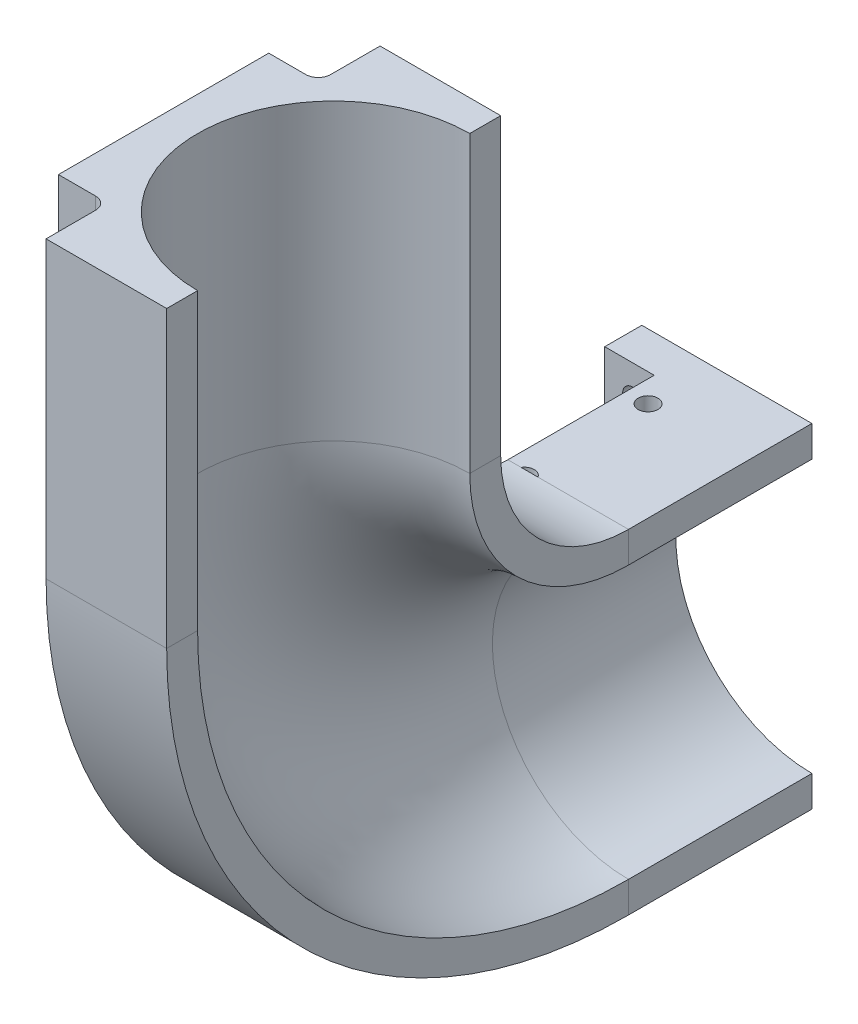
from build123d import *

# Parameters (mm, degrees)
EXTRUDE_1_DEPTH     = 6
SKETCH_4_R          = 1.6
CUT_EXTRUDE_1_DEPTH = 123.810830164
SKETCH_5_R          = 1.6
CUT_EXTRUDE_2_DEPTH = 20


with BuildPart() as part:
    # 草图1 → 凸台-拉伸1 (new body)
    with BuildSketch(Plane.XY):
        with BuildLine():
            Line((0, 0), (27.5, 0))
            Line((27.5, 0), (27.5, -5))
            ThreePointArc((27.5, -5), (5.5, -27), (27.5, -49))
            Line((27.5, -49), (27.5, -54))
            Line((27.5, -54), (0, -54))
            Line((0, -54), (0, 0))
        make_face()
    extrude(amount=EXTRUDE_1_DEPTH)

    # 扫描1: sweep along a path in 草图3
    with BuildLine(Plane(origin=(27.5, 0, 0), x_dir=(0, 0, -1), z_dir=(1, 0, 0))) as sweep_1_path:
        Line((-6, -27), (-29.66, -27))
        ThreePointArc((-29.66, -27), (-63.360709191, -13.040709191), (-77.32, 20.66))
        Line((-77.32, 20.66), (-77.32, 68.26))
    # 草图2 → 扫描1 (sweep)
    with BuildSketch(Plane.XY.offset(6)):
        with BuildLine():
            Line((8, 0), (8, -8))
            ThreePointArc((8, -8), (7.414213562, -9.414213562), (6, -10))
            Line((6, -10), (0, -10))
            Line((0, -10), (0, -44))
            Line((0, -44), (6, -44))
            ThreePointArc((6, -44), (7.414213562, -44.585786438), (8, -46))
            Line((8, -46), (8, -54))
            Line((8, -54), (27.5, -54))
            Line((27.5, -54), (27.5, -49))
            ThreePointArc((27.5, -49), (5.5, -27), (27.5, -5))
            Line((27.5, -5), (27.5, 0))
            Line((27.5, 0), (8, 0))
        make_face()
    sweep(path=sweep_1_path.line)

    # 草图4 → 切除-拉伸1 (cut, through all)
    with BuildSketch(Plane.XY.offset(6)):
        with Locations((4.5, -5)):
            Circle(SKETCH_4_R)
    cut_extrude_1 = extrude(amount=-CUT_EXTRUDE_1_DEPTH, mode=Mode.SUBTRACT)

    # 镜向1: 切除-拉伸1 across plane
    add(cut_extrude_1.mirror(Plane.ZX.offset(-27)), mode=Mode.SUBTRACT)

    # 草图5 → 切除-拉伸2 (cut)
    with BuildSketch(Plane(origin=(0, 0, 0), x_dir=(1, 0, 0), z_dir=(0, 1, 0))):
        with Locations((11.5, -10.5)):
            Circle(SKETCH_5_R)
        with Locations((11.5, -30.5)):
            Circle(SKETCH_5_R)
    extrude(amount=-CUT_EXTRUDE_2_DEPTH, mode=Mode.SUBTRACT)


solid = part.part
